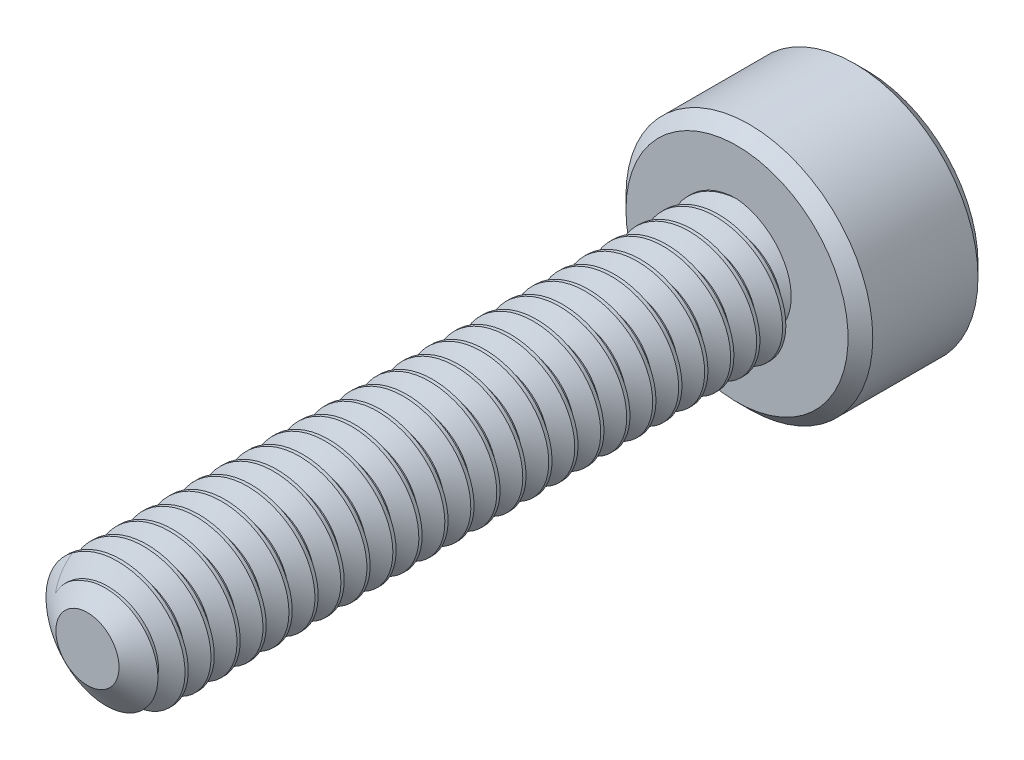
from build123d import *

# Parameters (mm, degrees)
SKETCH1_R          = 1
EXTRUDE1_DEPTH     = 10
CUT_SWEEP1_PITCH   = 0.4
SKETCH6_R          = 1.9
EXTRUDE2_DEPTH     = 2
CUT_EXTRUDE1_DEPTH = 1.125
CHAMFER1_SIZE      = 0.19


with BuildPart() as part:
    # Sketch1 → Extrude1 (new body)
    with BuildSketch(Plane.XY):
        Circle(SKETCH1_R)
    extrude(amount=-EXTRUDE1_DEPTH)

    # Cut-Sweep1: the profile of Sketch3 profile screwed along a right-hand helix of 26 turns, 6 arcs to a turn; built about Z, then put on its axis
    cut_sweep1_z = Axis((0, 0, 0), (0, 0, 1))
    cut_sweep1_corners = [(1.0003, 0, -0.350173205), (0.740192379, 0, -0.2), (0.740192379, 0, -0.15), (1.0003, 0, 0.000173205)]
    with BuildLine(mode=Mode.PRIVATE) as cut_sweep1_profile:
        Line(cut_sweep1_corners[0], cut_sweep1_corners[1])
        Line(cut_sweep1_corners[1], cut_sweep1_corners[2])
        Line(cut_sweep1_corners[2], cut_sweep1_corners[3])
        Line(cut_sweep1_corners[3], cut_sweep1_corners[0])
    cut_sweep1_cap = Face(cut_sweep1_profile.wire())
    cut_sweep1_turn_angles = [0, 30, 60, 90, 120, 150, 180, 210, 240, 270, 300, 330, 360]
    cut_sweep1_turn_weights = [1, 0.8660254037844387, 1, 0.8660254037844387, 1, 0.8660254037844387, 1, 0.8660254037844387, 1, 0.8660254037844387, 1, 0.8660254037844387, 1]
    cut_sweep1_turn_rails = [Edge.make_bspline([Vector(p[0], p[1], 0).rotate(cut_sweep1_z, cut_sweep1_turn_angles[k]) / cut_sweep1_turn_weights[k] + Vector(0, 0, p[2] + CUT_SWEEP1_PITCH * cut_sweep1_turn_angles[k] / 360) for k in range(13)], [0, 0, 0, 1, 1, 2, 2, 3, 3, 4, 4, 5, 5, 6, 6, 6], 2, cut_sweep1_turn_weights) for p in cut_sweep1_corners]
    cut_sweep1_turn_sides = [Face.make_surface_from_curves(cut_sweep1_turn_rails[p[0]], cut_sweep1_turn_rails[p[1]]) for p in [(0, 1), (1, 2), (2, 3), (3, 0)]]
    cut_sweep1 = Plane(origin=(0, 0, 0), x_dir=(0, 1, 0), z_dir=(0, 0, -1)) * Solid(Shell([*[p.moved(Location((0, 0, CUT_SWEEP1_PITCH * i))) for i in range(26) for p in cut_sweep1_turn_sides], cut_sweep1_cap, cut_sweep1_cap.rotate(cut_sweep1_z, 9360).moved(Location((0, 0, CUT_SWEEP1_PITCH * 9360 / 360)))]))
    add(cut_sweep1, mode=Mode.SUBTRACT)

    # Sketch4 → Cut-Revolve1 (revolve, cut)
    with BuildSketch(Plane(origin=(0, 0, 0), x_dir=(0, 0, -1), z_dir=(1, 0, 0)), mode=Mode.PRIVATE) as cut_revolve1_sk:
        Polygon((0.35977197, 1), (0, 0.486192379), (0, 1), align=None)
    revolve(cut_revolve1_sk.sketch.rotate(Axis((0, 0, 0), (0, 0, -1)), 278.428757723), axis=Axis((0, 0, 0), (0, 0, -1)), mode=Mode.SUBTRACT)

    # Sketch6 → Extrude2 (add)
    with BuildSketch(Plane(origin=(0, 0, -10), x_dir=(-1, 0, 0), z_dir=(0, 0, -1))):
        Circle(SKETCH6_R)
    extrude(amount=EXTRUDE2_DEPTH)

    # Sketch7 → Cut-Extrude1 (cut)
    with BuildSketch(Plane(origin=(0, 0, -12), x_dir=(-1, 0, 0), z_dir=(0, 0, -1))):
        Polygon((0, 0.866025404), (-0.75, 0.433012702), (-0.75, -0.433012702), (0, -0.866025404), (0.75, -0.433012702), (0.75, 0.433012702), align=None)
    extrude(amount=-CUT_EXTRUDE1_DEPTH, mode=Mode.SUBTRACT)

    # Cut-Extrude2 cone 1 section (through the dimple's axis) → Cut-Extrude2 (revolve, cut)
    with BuildSketch(Plane(origin=(0, 0, -12), x_dir=(0, 1, 0), z_dir=(1, 0, 0))):
        Polygon((0, 0), (0.866025404, 0), (0, 0.866025404), align=None)
    revolve(axis=Axis((0, 0, -12), (0, 0, 1)), mode=Mode.SUBTRACT)

    # Chamfer1
    chamfer1_edges = [part.edges().sort_by_distance(p)[0] for p in [
        (1.9, 0, -10),
        (1.9, 0, -12),
    ]]
    chamfer(chamfer1_edges, length=CHAMFER1_SIZE)


solid = part.part
